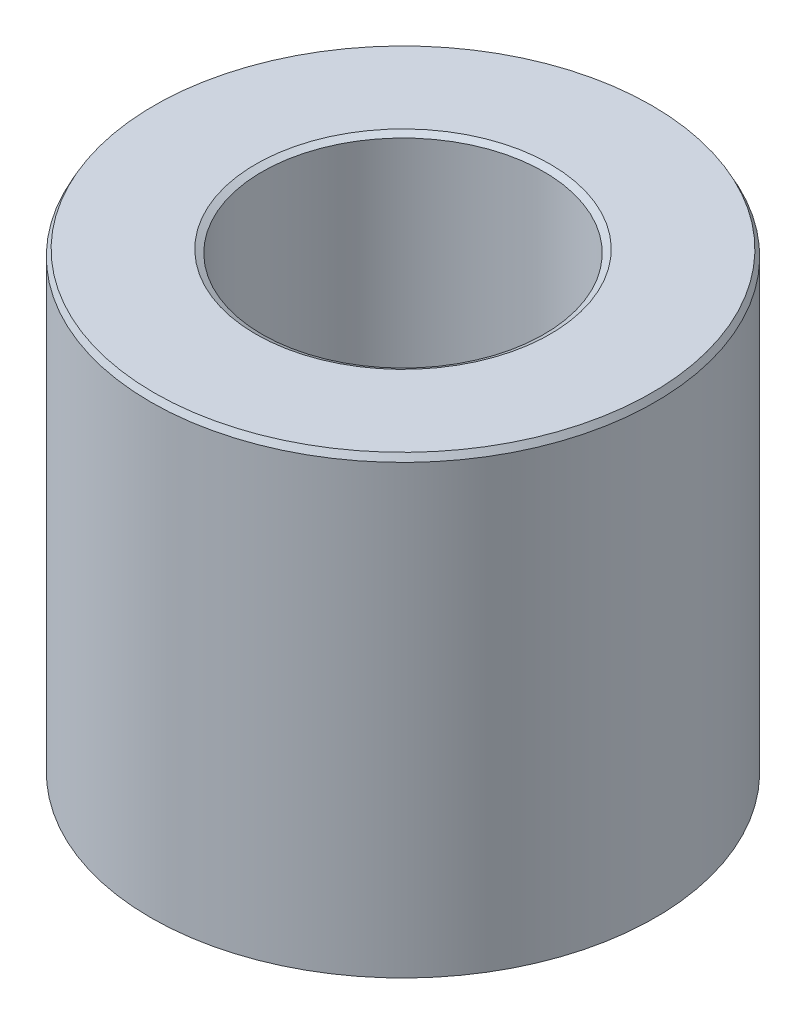
from build123d import *
from OCP.BRepFilletAPI import BRepFilletAPI_MakeChamfer

# Parameters (mm, degrees)
SKETCH1_R           = 25
BOSS_EXTRUDE1_DEPTH = 45.223362372
SKETCH2_R           = 13.965699241
CUT_EXTRUDE1_DEPTH  = 58.403418925
CHAMFER1_SIZE       = 0.629903351
CHAMFER1_SIZE2      = 0.334861874


with BuildPart() as part:
    # Sketch1 → Boss-Extrude1 (new body)
    with BuildSketch(Plane(origin=(0, 0, 0), x_dir=(1, 0, 0), z_dir=(0, 1, 0))):
        Circle(SKETCH1_R)
    extrude(amount=BOSS_EXTRUDE1_DEPTH)

    # Sketch2 → Cut-Extrude1 (cut, through all)
    with BuildSketch(Plane(origin=(0, 0, 0), x_dir=(1, 0, 0), z_dir=(0, 1, 0))):
        Circle(SKETCH2_R)
    extrude(amount=CUT_EXTRUDE1_DEPTH, mode=Mode.SUBTRACT)

    # Chamfer1: one chamfer whose edges measure the first distance from different faces: ONE call of the kernel's chamfer builder (chamfer() names one face for all edges)
    chamfer1_edges_1 = [part.edges().sort_by_distance(p)[0] for p in [
        (-13.965699241, 45.223362372, 0),
    ]]
    chamfer1_side_1 = [part.faces().sort_by_distance(p)[0] for p in [
        (-24.292893219, 45.223362372, 0),
    ]]
    chamfer1_edges_2 = [part.edges().sort_by_distance(p)[0] for p in [
        (-13.965699241, 0, 0),
    ]]
    chamfer1_side_2 = [part.faces().sort_by_distance(p)[0] for p in [
        (-13.965699241, 22.611681186, 0),
    ]]
    chamfer1_edges_3 = [part.edges().sort_by_distance(p)[0] for p in [
        (-25, 0, 0),
    ]]
    chamfer1_side_3 = [part.faces().sort_by_distance(p)[0] for p in [
        (-24.292893219, 0, 0),
    ]]
    chamfer1_edges_4 = [part.edges().sort_by_distance(p)[0] for p in [
        (-25, 45.223362372, 0),
    ]]
    chamfer1_side_4 = [part.faces().sort_by_distance(p)[0] for p in [
        (-25, 22.611681186, 0),
    ]]
    chamfer1 = BRepFilletAPI_MakeChamfer(part.part.solid().wrapped)
    for e in chamfer1_edges_1:
        chamfer1.Add(CHAMFER1_SIZE, CHAMFER1_SIZE2, e.wrapped, chamfer1_side_1[0].wrapped)  # the first distance lies on this face
    for e in chamfer1_edges_2:
        chamfer1.Add(CHAMFER1_SIZE, CHAMFER1_SIZE2, e.wrapped, chamfer1_side_2[0].wrapped)  # the first distance lies on this face
    for e in chamfer1_edges_3:
        chamfer1.Add(CHAMFER1_SIZE, CHAMFER1_SIZE2, e.wrapped, chamfer1_side_3[0].wrapped)  # the first distance lies on this face
    for e in chamfer1_edges_4:
        chamfer1.Add(CHAMFER1_SIZE, CHAMFER1_SIZE2, e.wrapped, chamfer1_side_4[0].wrapped)  # the first distance lies on this face
    add(Compound.cast(chamfer1.Shape()), mode=Mode.REPLACE)


solid = part.part
